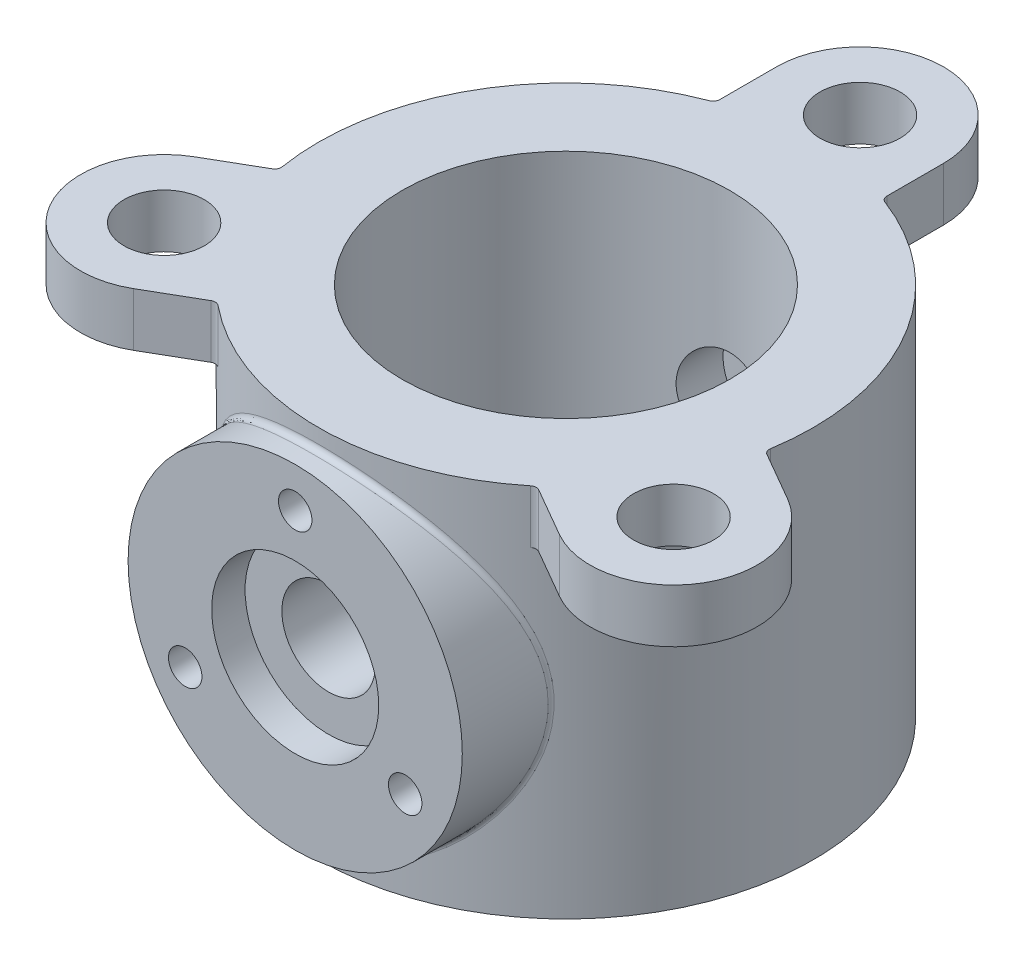
from build123d import *
from build123d.topology import SkipClean

# Parameters (mm, degrees)
SKETCH2_R                                = 24.5
SKETCH2_R_2                              = 6
BOSS_EXTRUDE2_DEPTH                      = 8
BOSS_EXTRUDE3_START                      = 48
SKETCH3_R                                = 37
BOSS_EXTRUDE3_DEPTH                      = 48
CUT_EXTRUDE1_REACH                       = 91.762
SKETCH4_R                                = 24.5
BOSS_EXTRUDE4_REACH                      = 121.473
BOSS_EXTRUDE4_END_RADIUS                 = 37
SKETCH5_R                                = 25
CBORE_FOR_M24_HEX_HEAD_BOLT1_D           = 14
CBORE_FOR_M24_HEX_HEAD_BOLT1_DEPTH       = 71
CBORE_FOR_M24_HEX_HEAD_BOLT1_CBORE_D     = 25
CBORE_FOR_M24_HEX_HEAD_BOLT1_CBORE_DEPTH = 5
F_5_0MM_DOWEL_HOLE1_D                    = 5
F_5_0MM_DOWEL_HOLE1_DEPTH                = 8
CIRPATTERN1_COUNT                        = 3
FILLET1_R                                = 0.85
FILLET2_DEPTH                            = 8


with BuildPart() as part:
    # Sketch2 → Boss-Extrude2 (new body)
    with BuildSketch(Plane(origin=(0, 0, 0), x_dir=(1, 0, 0), z_dir=(0, 1, 0))):
        with BuildLine():
            Line((-12.5, 44), (-12.5, 34.824560299))
            ThreePointArc((-12.5, 34.824560299), (-32.04293994, 18.5), (-36.408953894, -6.586962602))
            Line((-36.408953894, -6.586962602), (-44.355117767, -11.174682453))
            ThreePointArc((-44.355117767, -11.174682453), (-48.930435314, -28.25), (-31.855117767, -32.825317547))
            Line((-31.855117767, -32.825317547), (-23.908953894, -28.237597697))
            ThreePointArc((-23.908953894, -28.237597697), (0, -37), (23.908953894, -28.237597697))
            Line((23.908953894, -28.237597697), (31.855117767, -32.825317547))
            ThreePointArc((31.855117767, -32.825317547), (48.930435314, -28.25), (44.355117767, -11.174682453))
            Line((44.355117767, -11.174682453), (36.408953894, -6.586962602))
            ThreePointArc((36.408953894, -6.586962602), (32.04293994, 18.5), (12.5, 34.824560299))
            Line((12.5, 34.824560299), (12.5, 44))
            ThreePointArc((12.5, 44), (0, 56.5), (-12.5, 44))
        make_face()
        with Locations(Location((0, 0, 0), (0, 0, 270))):
            Circle(SKETCH2_R, mode=Mode.SUBTRACT)
        with Locations(Location((0, 44, 0), (0, 0, 270))):
            Circle(SKETCH2_R_2, mode=Mode.SUBTRACT)
        with Locations(Location((38.105117767, -22, 0), (0, 0, 270))):
            Circle(SKETCH2_R_2, mode=Mode.SUBTRACT)
        with Locations(Location((-38.105117767, -22, 0), (0, 0, 270))):
            Circle(SKETCH2_R_2, mode=Mode.SUBTRACT)
    extrude(amount=BOSS_EXTRUDE2_DEPTH)

    # Sketch3 → Boss-Extrude3 (add)
    with SkipClean():  # the faces are left unmerged after this step: merging them gives an invalid solid
        with BuildSketch(Plane.XZ.offset(BOSS_EXTRUDE3_START)):
            with Locations(Location((0, 0, 0), (0, 0, 270))):
                Circle(SKETCH3_R)
        extrude(amount=-BOSS_EXTRUDE3_DEPTH)

    # Sketch4 → Cut-Extrude1 (cut, up to next)
    with BuildSketch(Plane(origin=(0, 0, 0), x_dir=(1, 0, 0), z_dir=(0, 1, 0)), mode=Mode.PRIVATE) as cut_extrude1_sk1:
        with Locations(Location((0, 0, 0), (0, 0, 90))):
            Circle(SKETCH4_R)
    cut_extrude1_tool1 = extrude(cut_extrude1_sk1.sketch, amount=-CUT_EXTRUDE1_REACH, mode=Mode.PRIVATE) & part.part
    add(cut_extrude1_tool1.solids().sort_by_distance((0, 0, 0))[0], mode=Mode.SUBTRACT)

    # Boss-Extrude4: up to this cylinder (the profile starts outside it)
    with SkipClean():  # the faces are left unmerged after this step: merging them gives an invalid solid
        boss_extrude4_end = Plane(origin=(0, -20, 0), z_dir=(0, -1, 0)) * Cylinder(BOSS_EXTRUDE4_END_RADIUS, 317.946, mode=Mode.PRIVATE)
        # Sketch5 → Boss-Extrude4 (add, up to the surface)
        with BuildSketch(Plane.XY.offset(40.5), mode=Mode.PRIVATE) as boss_extrude4_sk1:
            with Locations((0, -20)):
                Circle(SKETCH5_R)
        boss_extrude4_tool1 = extrude(boss_extrude4_sk1.sketch, amount=-BOSS_EXTRUDE4_REACH, mode=Mode.PRIVATE) - boss_extrude4_end
        add(boss_extrude4_tool1.solids().sort_by_distance((0, -20, 40.5))[0])

    # CBORE for M24 Hex Head Bolt1
    with Locations(Plane(origin=(0, -20, 40.5), x_dir=(1, 0, 0), z_dir=(0, 0, 1))):
        with Locations((0, 0)):
            CounterBoreHole(CBORE_FOR_M24_HEX_HEAD_BOLT1_D / 2, CBORE_FOR_M24_HEX_HEAD_BOLT1_CBORE_D / 2, CBORE_FOR_M24_HEX_HEAD_BOLT1_CBORE_DEPTH, depth=CBORE_FOR_M24_HEX_HEAD_BOLT1_DEPTH)

    # Ø5.0mm Dowel Hole1
    with Locations(Plane(origin=(0, -1, 40.5), x_dir=(1, 0, 0), z_dir=(0, 0, 1))):
        with Locations((0, 0)):
            f_5_0mm_dowel_hole1 = Hole(F_5_0MM_DOWEL_HOLE1_D / 2, depth=F_5_0MM_DOWEL_HOLE1_DEPTH)

    # CirPattern1: Ø5.0mm Dowel Hole1 ×3 about axis
    with SkipClean():  # the faces are left unmerged after this step: merging them gives an invalid solid
        cirpattern1_axis = Axis((0, -20, 0), (0, 0, 1))
        for i in range(1, CIRPATTERN1_COUNT):
            add(f_5_0mm_dowel_hole1.rotate(cirpattern1_axis, i * 360 / CIRPATTERN1_COUNT), mode=Mode.SUBTRACT)

    # Fillet1
    fillet1_edges = [part.edges().sort_by_distance(p)[0] for p in [
        (-11.487639597, -42.204371972, 35.171496069),
    ]]
    fillet(fillet1_edges, radius=FILLET1_R)

    # Fillet2: read off the stored shape, not the designer's step
    # Fillet2 outline → Fillet2 (add)
    with SkipClean():  # the faces are left unmerged after this step: merging them gives an invalid solid
        with BuildSketch(Plane(origin=(0, 0, 0), x_dir=(1, 0, 0), z_dir=(0, 1, 0))):
            with BuildLine():
                ThreePointArc((-36.408953894, -6.586962602), (-36.468564966, -6.248501365), (-36.525029739, -5.909501043))
                ThreePointArc((-36.525029739, -5.909501043), (-36.60889325, -6.498227889), (-37.012192705, -6.935242692))
                Line((-37.012192705, -6.935242692), (-36.408953894, -6.586962602))
            make_face()
            with BuildLine():
                ThreePointArc((-12.5, 35.521120478), (-12.676816194, 34.953345504), (-13.144736842, 34.586354149))
                ThreePointArc((-13.144736842, 34.586354149), (-12.822921565, 34.706954383), (-12.5, 34.824560299))
                Line((-12.5, 34.824560299), (-12.5, 35.521120478))
            make_face()
            with BuildLine():
                ThreePointArc((-23.380292897, -28.676853106), (-23.645643401, -28.458453018), (-23.908953894, -28.237597697))
                Line((-23.908953894, -28.237597697), (-24.512192705, -28.585877786))
                ThreePointArc((-24.512192705, -28.585877786), (-23.932077057, -28.455117615), (-23.380292897, -28.676853106))
            make_face()
            with BuildLine():
                Line((12.5, 35.521120478), (12.5, 34.824560299))
                ThreePointArc((12.5, 34.824560299), (12.822921565, 34.706954383), (13.144736842, 34.586354149))
                ThreePointArc((13.144736842, 34.586354149), (12.676816194, 34.953345504), (12.5, 35.521120478))
            make_face()
            with BuildLine():
                ThreePointArc((23.908953894, -28.237597697), (23.645643401, -28.458453018), (23.380292897, -28.676853106))
                ThreePointArc((23.380292897, -28.676853106), (23.932077057, -28.455117615), (24.512192705, -28.585877786))
                Line((24.512192705, -28.585877786), (23.908953894, -28.237597697))
            make_face()
            with BuildLine():
                ThreePointArc((37.012192705, -6.935242692), (36.60889325, -6.498227889), (36.525029739, -5.909501043))
                ThreePointArc((36.525029739, -5.909501043), (36.468564966, -6.248501365), (36.408953894, -6.586962602))
                Line((36.408953894, -6.586962602), (37.012192705, -6.935242692))
            make_face()
        extrude(amount=FILLET2_DEPTH)


solid = part.part
